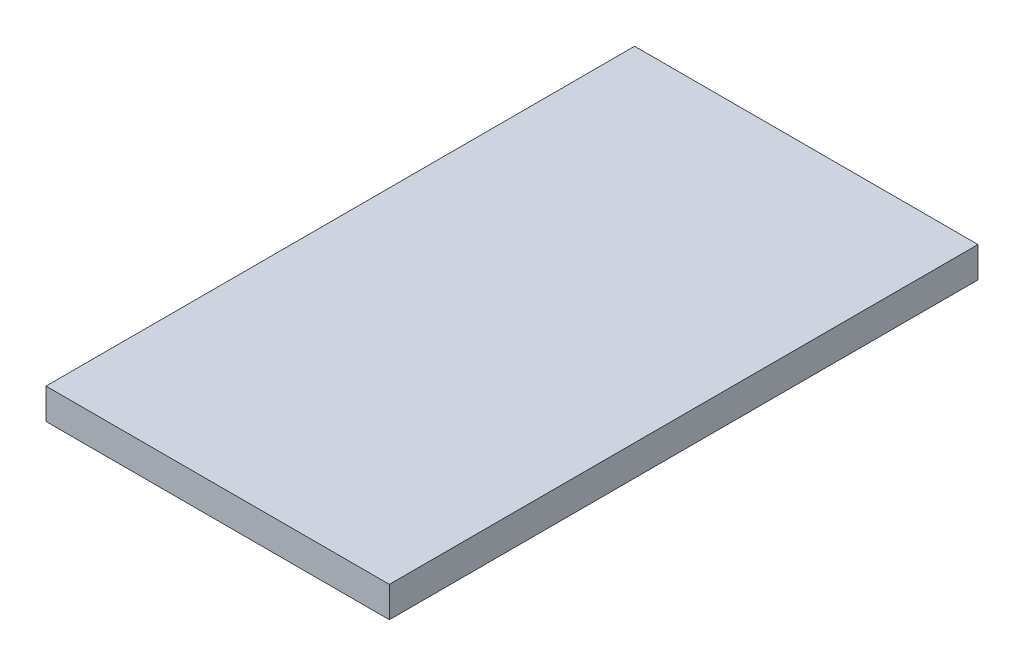
from build123d import *

# Parameters (mm, degrees)
SKETCH1_W           = 355.6
SKETCH1_H           = 609.6
BOSS_EXTRUDE1_DEPTH = 31.75


with BuildPart() as part:
    # Sketch1 → Boss-Extrude1 (new body)
    with BuildSketch(Plane(origin=(0, 0, 0), x_dir=(1, 0, 0), z_dir=(0, 1, 0))):
        Rectangle(SKETCH1_W, SKETCH1_H)
    extrude(amount=BOSS_EXTRUDE1_DEPTH)


solid = part.part
